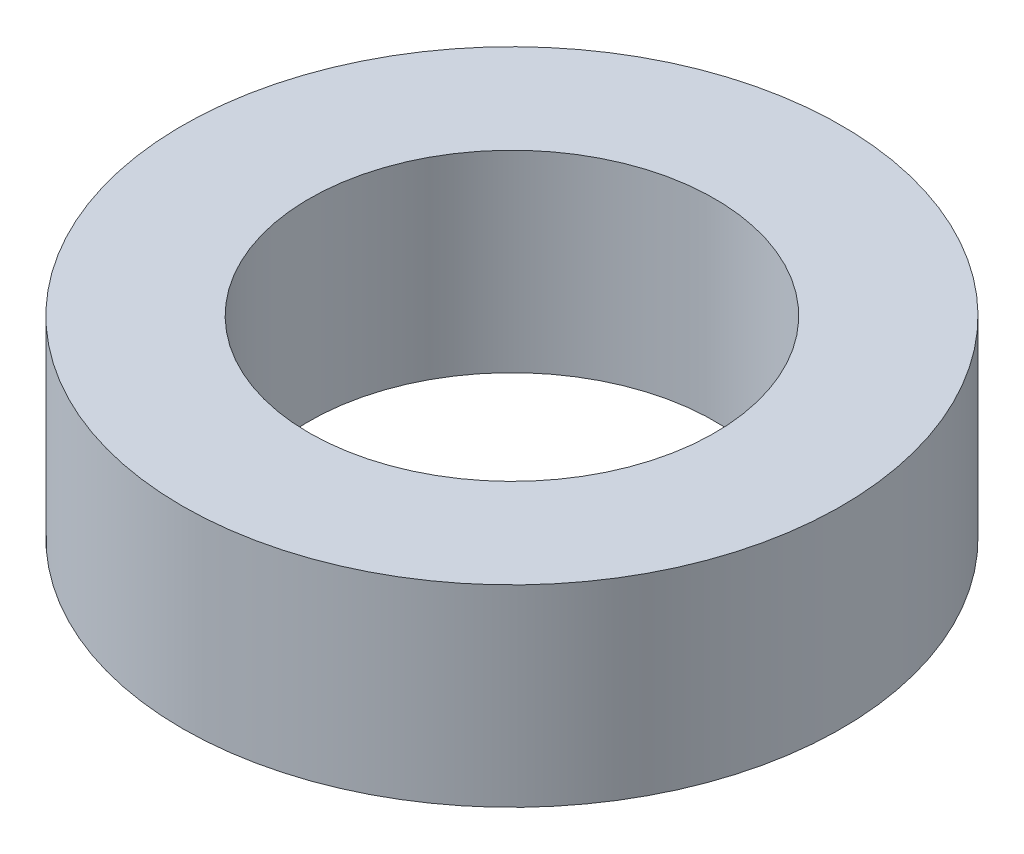
from build123d import *

# Parameters (mm, degrees)
SKETCH1_R           = 32.5
BOSS_EXTRUDE1_DEPTH = 19
SKETCH2_R           = 20
CUT_EXTRUDE1_DEPTH  = 50.734294003


with BuildPart() as part:
    # Sketch1 → Boss-Extrude1 (new body)
    with BuildSketch(Plane(origin=(0, 0, 0), x_dir=(1, 0, 0), z_dir=(0, 1, 0))):
        Circle(SKETCH1_R)
    extrude(amount=BOSS_EXTRUDE1_DEPTH)

    # Sketch2 → Cut-Extrude1 (cut, through all)
    with BuildSketch(Plane(origin=(0, 0, 0), x_dir=(1, 0, 0), z_dir=(0, 1, 0))):
        Circle(SKETCH2_R)
    extrude(amount=CUT_EXTRUDE1_DEPTH, mode=Mode.SUBTRACT)


solid = part.part
